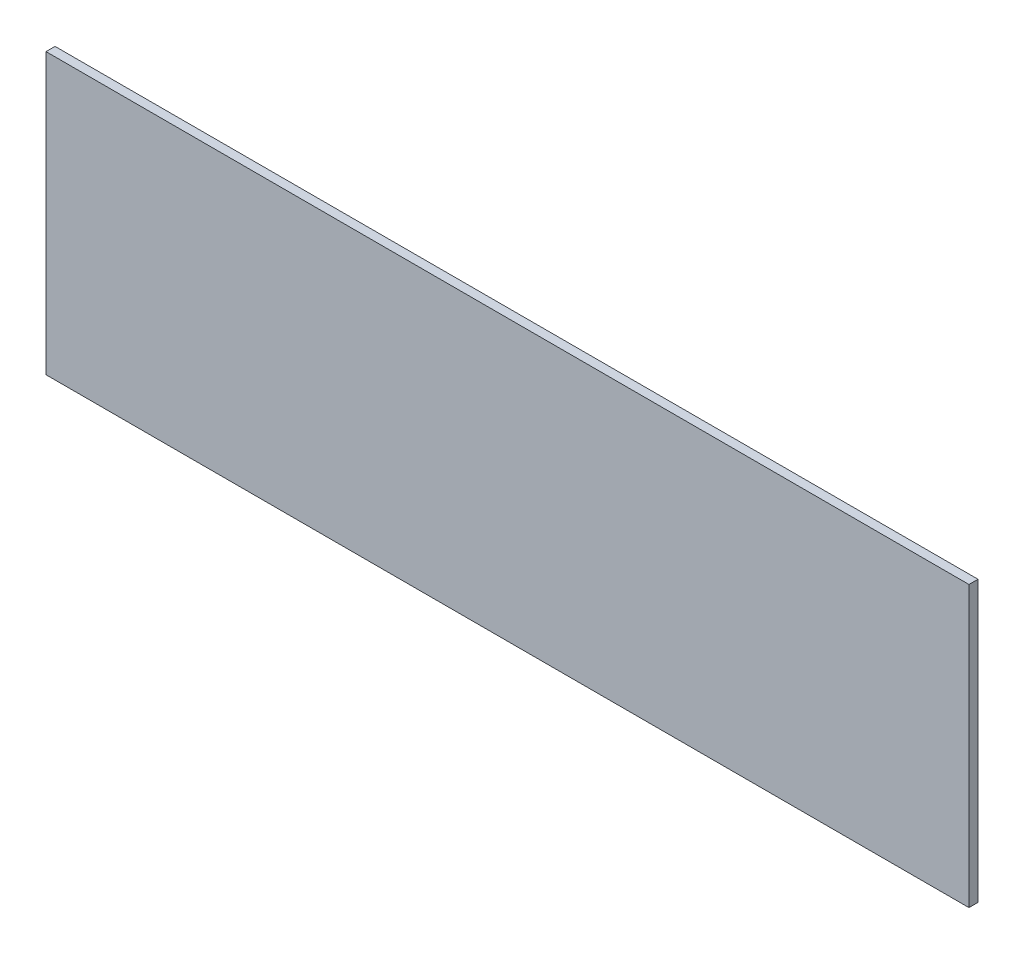
from build123d import *

# Parameters (mm, degrees)
SKETCH1_W           = 155
SKETCH1_H           = 47
BOSS_EXTRUDE1_DEPTH = 1.51892


with BuildPart() as part:
    # Sketch1 → Boss-Extrude1 (new body)
    with BuildSketch(Plane.XY):
        with Locations((77.5, 23.5)):
            Rectangle(SKETCH1_W, SKETCH1_H)
    extrude(amount=BOSS_EXTRUDE1_DEPTH)


solid = part.part
